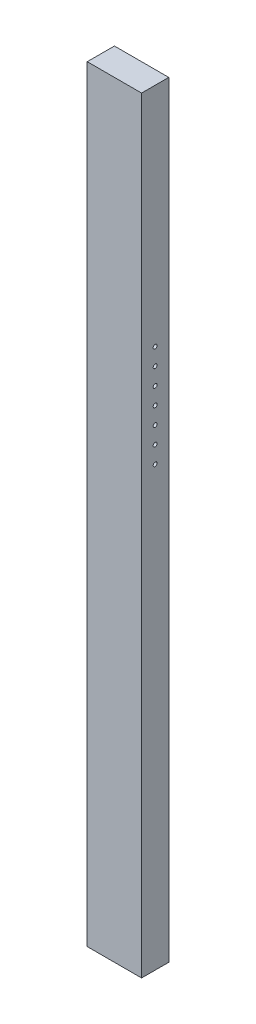
from build123d import *

# Parameters (mm, degrees)
ESQUISSE1_W                = 48
ESQUISSE1_H                = 677
BOSS_EXTRU_1_DEPTH         = 12
ESQUISSE2_R                = 1.75
ENL_V_MAT_EXTRU_1_DEPTH    = 343.096843014
R_P_TITION_LIN_AIRE1_COUNT = 7
R_P_TITION_LIN_AIRE1_PITCH = 15


with BuildPart() as part:
    # Esquisse1 → Boss.-Extru.1 (new, symmetric)
    with BuildSketch(Plane.XY):
        Rectangle(ESQUISSE1_W, ESQUISSE1_H)
    extrude(amount=BOSS_EXTRU_1_DEPTH, both=True)

    # Esquisse2 → Enlèv. mat.-Extru.1 (cut, through all)
    with BuildSketch(Plane(origin=(24, 0, 0), x_dir=(0, 0, -1), z_dir=(1, 0, 0))):
        with Locations((0, 48.5)):
            Circle(ESQUISSE2_R)
    enl_v_mat_extru_1 = extrude(amount=-ENL_V_MAT_EXTRU_1_DEPTH, mode=Mode.SUBTRACT)

    # Répétition linéaire1: Enlèv. mat.-Extru.1 ×7
    with Locations(*[(0, i * R_P_TITION_LIN_AIRE1_PITCH, 0) for i in range(1, R_P_TITION_LIN_AIRE1_COUNT)]):
        add(enl_v_mat_extru_1, mode=Mode.SUBTRACT)


solid = part.part
